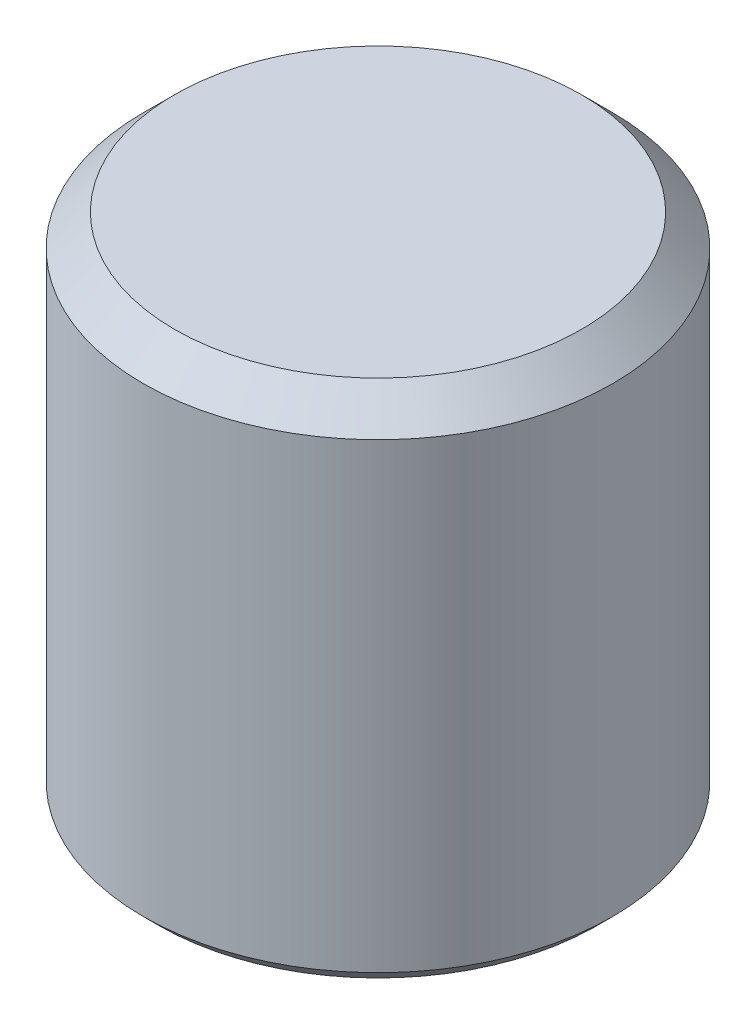
from build123d import *

# Parameters (mm, degrees)
SKETCH1_R           = 6
BOSS_EXTRUDE1_DEPTH = 13
SKETCH2_R           = 5
CUT_EXTRUDE1_DEPTH  = 10
CHAMFER1_SIZE       = 0.8
CHAMFER2_SIZE       = 0.4


with BuildPart() as part:
    # Sketch1 → Boss-Extrude1 (new body)
    with BuildSketch(Plane(origin=(0, 0, 0), x_dir=(1, 0, 0), z_dir=(0, 1, 0))):
        Circle(SKETCH1_R)
    extrude(amount=BOSS_EXTRUDE1_DEPTH)

    # Sketch2 → Cut-Extrude1 (cut)
    with BuildSketch(Plane.XZ):
        Circle(SKETCH2_R)
    extrude(amount=-CUT_EXTRUDE1_DEPTH, mode=Mode.SUBTRACT)

    # Chamfer1
    chamfer1_edges = [part.edges().sort_by_distance(p)[0] for p in [
        (-6, 13, 0),
    ]]
    chamfer(chamfer1_edges, length=CHAMFER1_SIZE)

    # Chamfer2
    chamfer2_edges = [part.edges().sort_by_distance(p)[0] for p in [
        (-6, 0, 0),
        (-5, 0, 0),
    ]]
    chamfer(chamfer2_edges, length=CHAMFER2_SIZE)


solid = part.part
